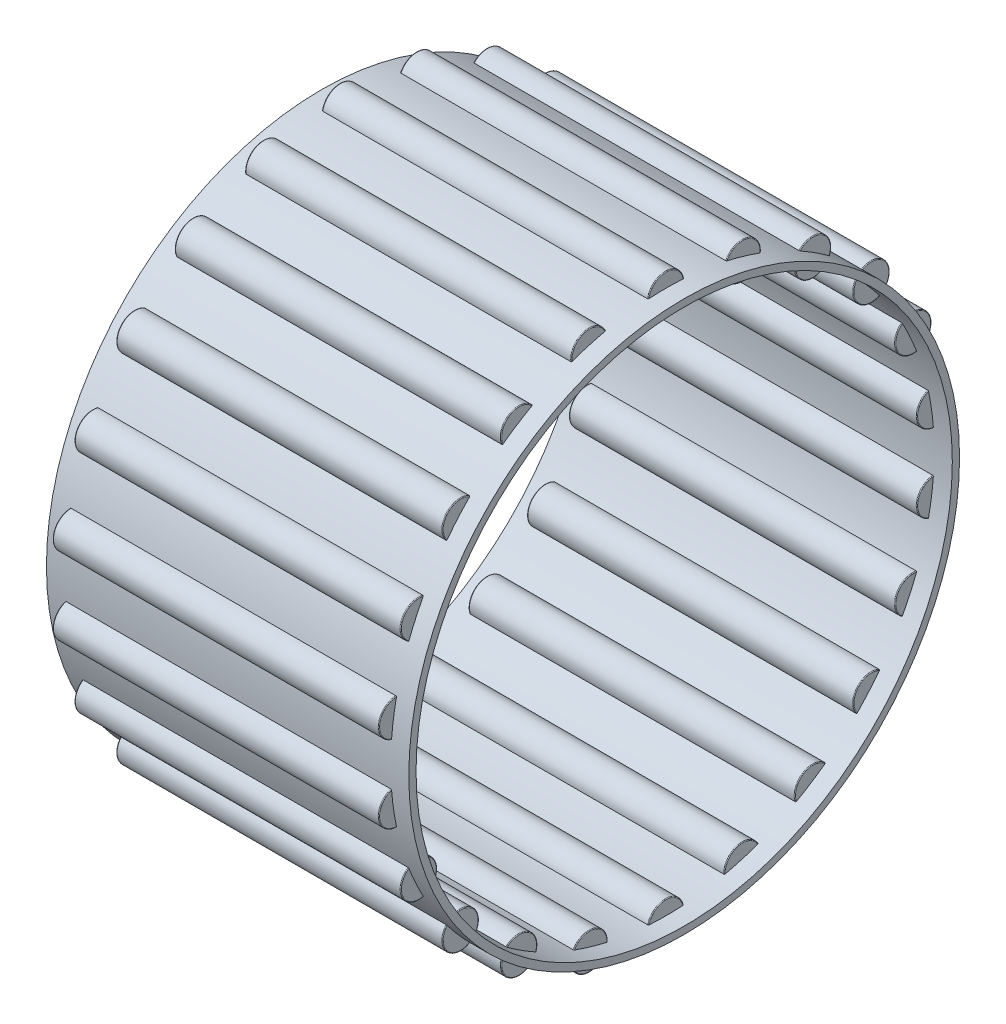
from build123d import *

# Parameters (mm, degrees)
CAGSPISKE_W           = 31.75
CAGSPISKE_H           = 0.635
ROLLERSDETAILED_COUNT = 22
ROLLERSDETAILED_ANGLE = 343.636363636


with BuildPart() as part:
    # CagSpiSke → CageSpine (revolve)
    with BuildSketch(Plane.XY):
        with Locations((0, 23.8125)):
            Rectangle(CAGSPISKE_W, CAGSPISKE_H)
    revolve(axis=Axis((-12.7, 0, 0), (1, 0, 0)))

    # RolDetSke → RollerDetailed (revolve)
    with BuildSketch(Plane.XY):
        with BuildLine():
            Line((-14.224, 25.4), (14.224, 25.4))
            ThreePointArc((14.224, 25.4), (14.268901281, 25.381401281), (14.2875, 25.3365))
            Line((14.2875, 25.3365), (14.2875, 23.8125))
            Line((14.2875, 23.8125), (-14.2875, 23.8125))
            Line((-14.2875, 23.8125), (-14.2875, 25.3365))
            ThreePointArc((-14.2875, 25.3365), (-14.268901281, 25.381401281), (-14.224, 25.4))
        make_face()
    rollerdetailed = revolve(axis=Axis((-17.78, 23.8125, 0), (1, 0, 0)))

    # RollersDetailed: RollerDetailed ×22 about axis
    rollersdetailed_axis = Axis((-50, 0, 0), (1, 0, 0))
    for i in range(1, ROLLERSDETAILED_COUNT):
        add(rollerdetailed.rotate(rollersdetailed_axis, i * ROLLERSDETAILED_ANGLE / (ROLLERSDETAILED_COUNT - 1)))


solid = part.part
